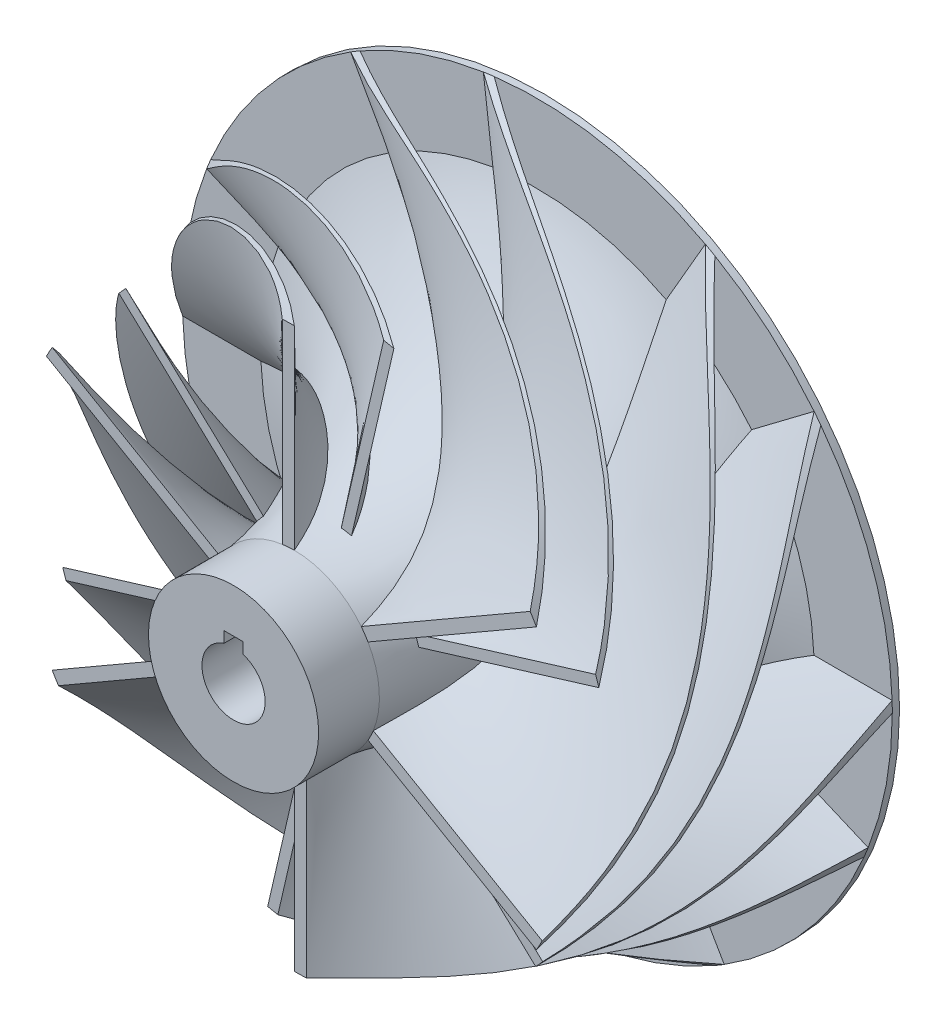
from build123d import *
from build123d.topology import SkipClean

# Parameters (mm, degrees)
CROQUIS1_R              = 37.21
SALIENTE_EXTRUIR1_DEPTH = 0.762
CROQUIS2_R              = 8.89
SALIENTE_EXTRUIR2_DEPTH = 25.4
MATRIZC1_COUNT          = 6
CROQUIS6_R              = 8.89
SALIENTE_EXTRUIR3_DEPTH = 6.35
CROQUIS7_R              = 3.3
CORTAR_EXTRUIR1_DEPTH   = 36.83
CORTAR_EXTRUIR4_START   = -3.81
CORTAR_EXTRUIR4_DEPTH   = 3.81
MATRIZC3_COUNT          = 6
CROQUIS10_R             = 5.97
CROQUIS10_R_2           = 3.3
SALIENTE_EXTRUIR5_DEPTH = 5.588
CORTAR_EXTRUIR5_START   = -46
CORTAR_EXTRUIR5_DEPTH   = 46


with BuildPart() as part:
    # Croquis1 → Saliente-Extruir1 (new body)
    with BuildSketch(Plane.XY):
        with Locations(Location((0, 0, 0), (0, 0, 180))):
            Circle(CROQUIS1_R)
    extrude(amount=SALIENTE_EXTRUIR1_DEPTH)

    # Croquis2 → Saliente-Extruir2 (add)
    with BuildSketch(Plane.XY.offset(0.762)):
        Circle(CROQUIS2_R)
    extrude(amount=SALIENTE_EXTRUIR2_DEPTH)

    # Recubrir1: read off the stored shape, not the designer's step
    # Recubrir1: loft between two sections, ruled curve by curve
    recubrir1_from = [
        Edge.make_bspline([(76.29, 1.14, 0.762), (63.575, 1.14, 0.762), (50.86, 1.14, 0.762), (25.43, 1.14, 0.762), (12.715, 1.14, 0.762), (0, 1.14, 0.762)], [0, 0, 0, 0, 0.5, 0.5, 1, 1, 1, 1], 3),
        Edge.make_bspline([(0, 0, 0.762), (12.715, 0, 0.762), (25.43, 0, 0.762), (50.86, 0, 0.762), (63.575, 0, 0.762), (76.29, 0, 0.762)], [0, 0, 0, 0, 0.5, 0.5, 1, 1, 1, 1], 3),
        Edge.make_bspline([(76.29, 0, 0.762), (76.29, 0.19, 0.762), (76.29, 0.38, 0.762), (76.29, 0.76, 0.762), (76.29, 0.95, 0.762), (76.29, 1.14, 0.762)], [0, 0, 0, 0, 0.5, 0.5, 1, 1, 1, 1], 3),
        Edge.make_line((0, 0, 0.762), (0, 1.14, 0.762)),
    ]
    recubrir1_to = [
        Edge.make_bspline([(1.26, -76.4, 26.162), (1.26, -63.666666667, 26.162), (1.26, -50.933333333, 26.162), (1.26, -25.466666667, 26.162), (1.26, -12.733333333, 26.162), (1.26, 0, 26.162)], [0, 0, 0, 0, 0.5, 0.5, 1, 1, 1, 1], 3),
        Edge.make_bspline([(0, 0, 26.162), (0, -12.733333333, 26.162), (0, -25.466666667, 26.162), (0, -50.933333333, 26.162), (0, -63.666666667, 26.162), (0, -76.4, 26.162)], [0, 0, 0, 0, 0.5, 0.5, 1, 1, 1, 1], 3),
        Edge.make_bspline([(0, -76.4, 26.162), (0.21, -76.4, 26.162), (0.42, -76.4, 26.162), (0.84, -76.4, 26.162), (1.05, -76.4, 26.162), (1.26, -76.4, 26.162)], [0, 0, 0, 0, 0.5, 0.5, 1, 1, 1, 1], 3),
        Edge.make_line((0, 0, 26.162), (1.26, 0, 26.162)),
    ]
    recubrir1 = Solid(Shell([*[Face.make_surface_from_curves(recubrir1_from[k], recubrir1_to[k]) for k in range(4)], Face(Wire(recubrir1_from)), Face(Wire(recubrir1_to))]))
    add(recubrir1)

    # MatrizC1: Recubrir1 ×6 about axis
    matrizc1_axis = Axis((0, 0, 26.1619), (0, 0, -1))
    for i in range(1, MATRIZC1_COUNT):
        add(recubrir1.rotate(matrizc1_axis, i * 360 / MATRIZC1_COUNT))

    # MatrizC2: read off the stored shape, not the designer's step
    # MatrizC2: loft between two sections, ruled curve by curve
    matrizc2_from = [
        Edge.make_bspline([(70.670748756, -28.75950226, 0.762), (58.966529545, -23.791355961, 0.762), (47.262310333, -18.823209662, 0.762), (23.85387191, -8.886917065, 0.762), (12.149652698, -3.918770766, 0.762), (0.445433486, 1.049375533, 0.762)], [0, 0, 0, 0, 0.5, 0.5, 1, 1, 1, 1], 3),
        Edge.make_bspline([(0, 0, 0.762), (11.704219212, -4.968146299, 0.762), (23.408438423, -9.936292597, 0.762), (46.816876847, -19.872585195, 0.762), (58.521096058, -24.840731494, 0.762), (70.22531527, -29.808877792, 0.762)], [0, 0, 0, 0, 0.5, 0.5, 1, 1, 1, 1], 3),
        Edge.make_bspline([(70.22531527, -29.808877792, 0.762), (70.299554184, -29.63398187, 0.762), (70.373793099, -29.459085948, 0.762), (70.522270928, -29.109294104, 0.762), (70.596509842, -28.934398182, 0.762), (70.670748756, -28.75950226, 0.762)], [0, 0, 0, 0, 0.5, 0.5, 1, 1, 1, 1], 3),
        Edge.make_line((0, 0, 0.762), (0.445433486, 1.049375533, 0.762)),
    ]
    matrizc2_to = [
        Edge.make_bspline([(-28.692022101, -70.818892026, 26.162), (-23.716712398, -59.097796892, 26.162), (-18.741402696, -47.376701758, 26.162), (-8.79078329, -23.93451149, 26.162), (-3.815473587, -12.213416356, 26.162), (1.159836115, -0.492321222, 26.162)], [0, 0, 0, 0, 0.5, 0.5, 1, 1, 1, 1], 3),
        Edge.make_bspline([(0, 0, 26.162), (-4.975309703, -11.721095134, 26.162), (-9.950619406, -23.442190268, 26.162), (-19.901238811, -46.884380536, 26.162), (-24.876548514, -58.60547567, 26.162), (-29.851858217, -70.326570804, 26.162)], [0, 0, 0, 0, 0.5, 0.5, 1, 1, 1, 1], 3),
        Edge.make_bspline([(-29.851858217, -70.326570804, 26.162), (-29.658552197, -70.408624341, 26.162), (-29.465246178, -70.490677878, 26.162), (-29.07863414, -70.654784952, 26.162), (-28.88532812, -70.736838489, 26.162), (-28.692022101, -70.818892026, 26.162)], [0, 0, 0, 0, 0.5, 0.5, 1, 1, 1, 1], 3),
        Edge.make_line((0, 0, 26.162), (1.159836115, -0.492321222, 26.162)),
    ]
    matrizc2 = Solid(Shell([*[Face.make_surface_from_curves(matrizc2_from[k], matrizc2_to[k]) for k in range(4)], Face(Wire(matrizc2_from)), Face(Wire(matrizc2_to))]))
    add(matrizc2)

    # MatrizC2 2: loft between two sections, ruled curve by curve
    matrizc2_2_from = [
        Edge.make_bspline([(10.428914821, -75.582414857, 0.762), (8.87934612, -62.962190539, 0.762), (7.329777418, -50.341966221, 0.762), (4.230640016, -25.101517585, 0.762), (2.681071314, -12.481293267, 0.762), (1.131502613, 0.138931051, 0.762)], [0, 0, 0, 0, 0.5, 0.5, 1, 1, 1, 1], 3),
        Edge.make_bspline([(0, 0, 0.762), (1.549568701, -12.620224318, 0.762), (3.099137403, -25.240448636, 0.762), (6.198274806, -50.480897272, 0.762), (7.747843507, -63.101121591, 0.762), (9.297412208, -75.721345909, 0.762)], [0, 0, 0, 0, 0.5, 0.5, 1, 1, 1, 1], 3),
        Edge.make_bspline([(9.297412208, -75.721345909, 0.762), (9.485995977, -75.698190733, 0.762), (9.674579746, -75.675035558, 0.762), (10.051747284, -75.628725208, 0.762), (10.240331052, -75.605570032, 0.762), (10.428914821, -75.582414857, 0.762)], [0, 0, 0, 0, 0.5, 0.5, 1, 1, 1, 1], 3),
        Edge.make_line((0, 0, 0.762), (1.131502613, 0.138931051, 0.762)),
    ]
    matrizc2_2_to = [
        Edge.make_bspline([(-75.676970613, -10.561425987, 26.162), (-63.038549615, -9.009623015, 26.162), (-50.400128618, -7.457820042, 26.162), (-25.123286622, -4.354214096, 26.162), (-12.484865625, -2.802411124, 26.162), (0.153555373, -1.250608151, 26.162)], [0, 0, 0, 0, 0.5, 0.5, 1, 1, 1, 1], 3),
        Edge.make_bspline([(0, 0, 26.162), (-12.638420998, -1.551802973, 26.162), (-25.276841995, -3.103605945, 26.162), (-50.55368399, -6.207211891, 26.162), (-63.192104988, -7.759014863, 26.162), (-75.830525985, -9.310817836, 26.162)], [0, 0, 0, 0, 0.5, 0.5, 1, 1, 1, 1], 3),
        Edge.make_bspline([(-75.830525985, -9.310817836, 26.162), (-75.804933423, -9.519252528, 26.162), (-75.779340861, -9.72768722, 26.162), (-75.728155737, -10.144556604, 26.162), (-75.702563175, -10.352991295, 26.162), (-75.676970613, -10.561425987, 26.162)], [0, 0, 0, 0, 0.5, 0.5, 1, 1, 1, 1], 3),
        Edge.make_line((0, 0, 26.162), (0.153555373, -1.250608151, 26.162)),
    ]
    matrizc2_2 = Solid(Shell([*[Face.make_surface_from_curves(matrizc2_2_from[k], matrizc2_2_to[k]) for k in range(4)], Face(Wire(matrizc2_2_from)), Face(Wire(matrizc2_2_to))]))
    add(matrizc2_2)

    # MatrizC2 3: loft between two sections, ruled curve by curve
    matrizc2_3_from = [
        Edge.make_bspline([(-60.241833935, -46.822912598, 0.762), (-50.087183425, -39.170834578, 0.762), (-39.932532915, -31.518756559, 0.762), (-19.623231894, -16.21460052, 0.762), (-9.468581384, -8.562522501, 0.762), (0.686069126, -0.910444481, 0.762)], [0, 0, 0, 0, 0.5, 0.5, 1, 1, 1, 1], 3),
        Edge.make_bspline([(0, 0, 0.762), (-10.15465051, -7.652078019, 0.762), (-20.309301021, -15.304156039, 0.762), (-40.618602041, -30.608312078, 0.762), (-50.773252551, -38.260390097, 0.762), (-60.927903062, -45.912468116, 0.762)], [0, 0, 0, 0, 0.5, 0.5, 1, 1, 1, 1], 3),
        Edge.make_bspline([(-60.927903062, -45.912468116, 0.762), (-60.813558207, -46.064208863, 0.762), (-60.699213353, -46.21594961, 0.762), (-60.470523644, -46.519431104, 0.762), (-60.35617879, -46.671171851, 0.762), (-60.241833935, -46.822912598, 0.762)], [0, 0, 0, 0, 0.5, 0.5, 1, 1, 1, 1], 3),
        Edge.make_line((0, 0, 0.762), (0.686069126, -0.910444481, 0.762)),
    ]
    matrizc2_3_to = [
        Edge.make_bspline([(-46.984948511, 60.257466038, 26.162), (-39.321837217, 50.088173877, 26.162), (-31.658725922, 39.918881716, 26.162), (-16.332503332, 19.580297393, 26.162), (-8.669392037, 9.411005232, 26.162), (-1.006280743, -0.758286929, 26.162)], [0, 0, 0, 0, 0.5, 0.5, 1, 1, 1, 1], 3),
        Edge.make_bspline([(0, 0, 26.162), (-7.663111295, 10.169292161, 26.162), (-15.32622259, 20.338584323, 26.162), (-30.652445179, 40.677168645, 26.162), (-38.315556474, 50.846460806, 26.162), (-45.978667769, 61.015752968, 26.162)], [0, 0, 0, 0, 0.5, 0.5, 1, 1, 1, 1], 3),
        Edge.make_bspline([(-45.978667769, 61.015752968, 26.162), (-46.146381226, 60.889371813, 26.162), (-46.314094683, 60.762990658, 26.162), (-46.649521597, 60.510228348, 26.162), (-46.817235054, 60.383847193, 26.162), (-46.984948511, 60.257466038, 26.162)], [0, 0, 0, 0, 0.5, 0.5, 1, 1, 1, 1], 3),
        Edge.make_line((0, 0, 26.162), (-1.006280743, -0.758286929, 26.162)),
    ]
    matrizc2_3 = Solid(Shell([*[Face.make_surface_from_curves(matrizc2_3_from[k], matrizc2_3_to[k]) for k in range(4)], Face(Wire(matrizc2_3_from)), Face(Wire(matrizc2_3_to))]))
    add(matrizc2_3)

    # MatrizC2 4: loft between two sections, ruled curve by curve
    matrizc2_4_from = [
        Edge.make_bspline([(-70.670748756, 28.75950226, 0.762), (-58.966529545, 23.791355961, 0.762), (-47.262310333, 18.823209662, 0.762), (-23.85387191, 8.886917065, 0.762), (-12.149652698, 3.918770766, 0.762), (-0.445433486, -1.049375533, 0.762)], [0, 0, 0, 0, 0.5, 0.5, 1, 1, 1, 1], 3),
        Edge.make_bspline([(0, 0, 0.762), (-11.704219212, 4.968146299, 0.762), (-23.408438423, 9.936292597, 0.762), (-46.816876847, 19.872585195, 0.762), (-58.521096058, 24.840731494, 0.762), (-70.22531527, 29.808877792, 0.762)], [0, 0, 0, 0, 0.5, 0.5, 1, 1, 1, 1], 3),
        Edge.make_bspline([(-70.22531527, 29.808877792, 0.762), (-70.299554184, 29.63398187, 0.762), (-70.373793099, 29.459085948, 0.762), (-70.522270928, 29.109294104, 0.762), (-70.596509842, 28.934398182, 0.762), (-70.670748756, 28.75950226, 0.762)], [0, 0, 0, 0, 0.5, 0.5, 1, 1, 1, 1], 3),
        Edge.make_line((0, 0, 0.762), (-0.445433486, -1.049375533, 0.762)),
    ]
    matrizc2_4_to = [
        Edge.make_bspline([(28.692022101, 70.818892026, 26.162), (23.716712398, 59.097796892, 26.162), (18.741402696, 47.376701758, 26.162), (8.79078329, 23.93451149, 26.162), (3.815473587, 12.213416356, 26.162), (-1.159836115, 0.492321222, 26.162)], [0, 0, 0, 0, 0.5, 0.5, 1, 1, 1, 1], 3),
        Edge.make_bspline([(0, 0, 26.162), (4.975309703, 11.721095134, 26.162), (9.950619406, 23.442190268, 26.162), (19.901238811, 46.884380536, 26.162), (24.876548514, 58.60547567, 26.162), (29.851858217, 70.326570804, 26.162)], [0, 0, 0, 0, 0.5, 0.5, 1, 1, 1, 1], 3),
        Edge.make_bspline([(29.851858217, 70.326570804, 26.162), (29.658552197, 70.408624341, 26.162), (29.465246178, 70.490677878, 26.162), (29.07863414, 70.654784952, 26.162), (28.88532812, 70.736838489, 26.162), (28.692022101, 70.818892026, 26.162)], [0, 0, 0, 0, 0.5, 0.5, 1, 1, 1, 1], 3),
        Edge.make_line((0, 0, 26.162), (-1.159836115, 0.492321222, 26.162)),
    ]
    matrizc2_4 = Solid(Shell([*[Face.make_surface_from_curves(matrizc2_4_from[k], matrizc2_4_to[k]) for k in range(4)], Face(Wire(matrizc2_4_from)), Face(Wire(matrizc2_4_to))]))
    add(matrizc2_4)

    # MatrizC2 5: loft between two sections, ruled curve by curve
    matrizc2_5_from = [
        Edge.make_bspline([(-10.428914821, 75.582414857, 0.762), (-8.87934612, 62.962190539, 0.762), (-7.329777418, 50.341966221, 0.762), (-4.230640016, 25.101517585, 0.762), (-2.681071314, 12.481293267, 0.762), (-1.131502613, -0.138931051, 0.762)], [0, 0, 0, 0, 0.5, 0.5, 1, 1, 1, 1], 3),
        Edge.make_bspline([(0, 0, 0.762), (-1.549568701, 12.620224318, 0.762), (-3.099137403, 25.240448636, 0.762), (-6.198274806, 50.480897272, 0.762), (-7.747843507, 63.101121591, 0.762), (-9.297412208, 75.721345909, 0.762)], [0, 0, 0, 0, 0.5, 0.5, 1, 1, 1, 1], 3),
        Edge.make_bspline([(-9.297412208, 75.721345909, 0.762), (-9.485995977, 75.698190733, 0.762), (-9.674579746, 75.675035558, 0.762), (-10.051747284, 75.628725208, 0.762), (-10.240331052, 75.605570032, 0.762), (-10.428914821, 75.582414857, 0.762)], [0, 0, 0, 0, 0.5, 0.5, 1, 1, 1, 1], 3),
        Edge.make_line((0, 0, 0.762), (-1.131502613, -0.138931051, 0.762)),
    ]
    matrizc2_5_to = [
        Edge.make_bspline([(75.676970613, 10.561425987, 26.162), (63.038549615, 9.009623015, 26.162), (50.400128618, 7.457820042, 26.162), (25.123286622, 4.354214096, 26.162), (12.484865625, 2.802411124, 26.162), (-0.153555373, 1.250608151, 26.162)], [0, 0, 0, 0, 0.5, 0.5, 1, 1, 1, 1], 3),
        Edge.make_bspline([(0, 0, 26.162), (12.638420998, 1.551802973, 26.162), (25.276841995, 3.103605945, 26.162), (50.55368399, 6.207211891, 26.162), (63.192104988, 7.759014863, 26.162), (75.830525985, 9.310817836, 26.162)], [0, 0, 0, 0, 0.5, 0.5, 1, 1, 1, 1], 3),
        Edge.make_bspline([(75.830525985, 9.310817836, 26.162), (75.804933423, 9.519252528, 26.162), (75.779340861, 9.72768722, 26.162), (75.728155737, 10.144556604, 26.162), (75.702563175, 10.352991295, 26.162), (75.676970613, 10.561425987, 26.162)], [0, 0, 0, 0, 0.5, 0.5, 1, 1, 1, 1], 3),
        Edge.make_line((0, 0, 26.162), (-0.153555373, 1.250608151, 26.162)),
    ]
    matrizc2_5 = Solid(Shell([*[Face.make_surface_from_curves(matrizc2_5_from[k], matrizc2_5_to[k]) for k in range(4)], Face(Wire(matrizc2_5_from)), Face(Wire(matrizc2_5_to))]))
    add(matrizc2_5)

    # MatrizC2 6: loft between two sections, ruled curve by curve
    matrizc2_6_from = [
        Edge.make_bspline([(60.241833935, 46.822912598, 0.762), (50.087183425, 39.170834578, 0.762), (39.932532915, 31.518756559, 0.762), (19.623231894, 16.21460052, 0.762), (9.468581384, 8.562522501, 0.762), (-0.686069126, 0.910444481, 0.762)], [0, 0, 0, 0, 0.5, 0.5, 1, 1, 1, 1], 3),
        Edge.make_bspline([(0, 0, 0.762), (10.15465051, 7.652078019, 0.762), (20.309301021, 15.304156039, 0.762), (40.618602041, 30.608312078, 0.762), (50.773252551, 38.260390097, 0.762), (60.927903062, 45.912468116, 0.762)], [0, 0, 0, 0, 0.5, 0.5, 1, 1, 1, 1], 3),
        Edge.make_bspline([(60.927903062, 45.912468116, 0.762), (60.813558207, 46.064208863, 0.762), (60.699213353, 46.21594961, 0.762), (60.470523644, 46.519431104, 0.762), (60.35617879, 46.671171851, 0.762), (60.241833935, 46.822912598, 0.762)], [0, 0, 0, 0, 0.5, 0.5, 1, 1, 1, 1], 3),
        Edge.make_line((0, 0, 0.762), (-0.686069126, 0.910444481, 0.762)),
    ]
    matrizc2_6_to = [
        Edge.make_bspline([(46.984948511, -60.257466038, 26.162), (39.321837217, -50.088173877, 26.162), (31.658725922, -39.918881716, 26.162), (16.332503332, -19.580297393, 26.162), (8.669392037, -9.411005232, 26.162), (1.006280743, 0.758286929, 26.162)], [0, 0, 0, 0, 0.5, 0.5, 1, 1, 1, 1], 3),
        Edge.make_bspline([(0, 0, 26.162), (7.663111295, -10.169292161, 26.162), (15.32622259, -20.338584323, 26.162), (30.652445179, -40.677168645, 26.162), (38.315556474, -50.846460806, 26.162), (45.978667769, -61.015752968, 26.162)], [0, 0, 0, 0, 0.5, 0.5, 1, 1, 1, 1], 3),
        Edge.make_bspline([(45.978667769, -61.015752968, 26.162), (46.146381226, -60.889371813, 26.162), (46.314094683, -60.762990658, 26.162), (46.649521597, -60.510228348, 26.162), (46.817235054, -60.383847193, 26.162), (46.984948511, -60.257466038, 26.162)], [0, 0, 0, 0, 0.5, 0.5, 1, 1, 1, 1], 3),
        Edge.make_line((0, 0, 26.162), (1.006280743, 0.758286929, 26.162)),
    ]
    matrizc2_6 = Solid(Shell([*[Face.make_surface_from_curves(matrizc2_6_from[k], matrizc2_6_to[k]) for k in range(4)], Face(Wire(matrizc2_6_from)), Face(Wire(matrizc2_6_to))]))
    add(matrizc2_6)

    # Croquis5 → Cortar-Revolución1 (revolve, cut)
    with BuildSketch(Plane(origin=(0, 0, 0), x_dir=(1, 0, 0), z_dir=(0, 1, 0)), mode=Mode.PRIVATE) as cortar_revoluci_n1_sk:
        with BuildLine():
            Line((-29.21, -59.34), (-82.05, -48.32))
            Line((-82.05, -48.32), (-95.86, -5.93))
            Line((-95.86, -5.93), (-53.21, 12.99))
            Line((-53.21, 12.99), (-43.06, 5.06))
            Line((-43.06, 5.06), (-37.08, 5.06))
            Line((-37.08, 5.06), (-37.08, 0))
            Line((-37.08, 0), (-37.08, -0.762))
            ThreePointArc((-37.08, -0.762), (-31.051600953, -12.812324888), (-29.21, -26.16))
            Line((-29.21, -26.16), (-29.21, -33.02))
            Line((-29.21, -33.02), (-29.21, -59.34))
        make_face()
    revolve(cortar_revoluci_n1_sk.sketch.rotate(Axis((0, 0, 26.1619), (0, 0, -1)), 180), axis=Axis((0, 0, 26.1619), (0, 0, -1)), mode=Mode.SUBTRACT)

    # Croquis6 → Saliente-Extruir3 (add)
    with BuildSketch(Plane.XY.offset(26.162)):
        Circle(CROQUIS6_R)
    extrude(amount=SALIENTE_EXTRUIR3_DEPTH)

    # Croquis7 → Cortar-Extruir1 (cut)
    with BuildSketch(Plane.XY.offset(32.512)):
        Circle(CROQUIS7_R)
    extrude(amount=-CORTAR_EXTRUIR1_DEPTH, mode=Mode.SUBTRACT)

    # Croquis8 → Cortar-Extruir4 (cut)
    with SkipClean():  # the faces are left unmerged after this step: merging them gives an invalid solid
        with BuildSketch(Plane.XY.offset(26.162).offset(CORTAR_EXTRUIR4_START)):
            with BuildLine():
                Line((7.69896584, 4.445), (42.893074548, 14.097775109))
                Line((42.893074548, 14.097775109), (45.361379742, 5.098311187))
                Line((45.361379742, 5.098311187), (8.660814524, -2.005590131))
                ThreePointArc((8.660814524, -2.005590131), (8.792788616, 1.311094333), (7.69896584, 4.445))
            make_face()
        cortar_extruir4 = extrude(amount=CORTAR_EXTRUIR4_DEPTH, mode=Mode.SUBTRACT)

    # MatrizC3: Cortar-Extruir4 ×6 about axis
    with SkipClean():  # the faces are left unmerged after this step: merging them gives an invalid solid
        matrizc3_axis = Axis((0, 0, 0), (0, 0, 1))
        for i in range(1, MATRIZC3_COUNT):
            add(cortar_extruir4.rotate(matrizc3_axis, i * 360 / MATRIZC3_COUNT), mode=Mode.SUBTRACT)

    # Croquis9 → Revolución1 (revolve)
    with BuildSketch(Plane(origin=(0, 0, 0), x_dir=(1, 0, 0), z_dir=(0, 1, 0)), mode=Mode.PRIVATE) as revoluci_n1_sk:
        with BuildLine():
            Line((-7.53, 0), (-28.913336772, -0.762))
            ThreePointArc((-28.913336772, -0.762), (-15.386304939, -10.690767474), (-8.89, -26.162))
            Line((-8.89, -26.162), (-4.82, -24.95))
            Line((-4.82, -24.95), (-7.53, 0))
        make_face()
    revolve(revoluci_n1_sk.sketch.rotate(Axis((0, 0, 26.1619), (0, 0, -1)), 21.851901558), axis=Axis((0, 0, 26.1619), (0, 0, -1)))

    # Croquis10 → Saliente-Extruir5 (add)
    with BuildSketch(Plane(origin=(0, 0, 0), x_dir=(-1, 0, 0), z_dir=(0, 0, -1))):
        with Locations(Location((0, 0, 0), (0, 0, 180))):
            Circle(CROQUIS10_R)
        with Locations(Location((0, 0, 0), (0, 0, 180))):
            Circle(CROQUIS10_R_2, mode=Mode.SUBTRACT)
    extrude(amount=SALIENTE_EXTRUIR5_DEPTH)

    # Croquis11 → Revolución2 (revolve)
    with BuildSketch(Plane(origin=(0, 0, 0), x_dir=(1, 0, 0), z_dir=(0, 1, 0)), mode=Mode.PRIVATE) as revoluci_n2_sk:
        with BuildLine():
            Line((-5.97, 5.588), (-4.61, 0))
            Line((-4.61, 0), (-26.11, 0))
            ThreePointArc((-26.11, 0), (-15.683249411, 1.508216739), (-5.97, 5.588))
        make_face()
    revolve(revoluci_n2_sk.sketch.rotate(Axis((0, 0, 26.1619), (0, 0, -1)), 180), axis=Axis((0, 0, 26.1619), (0, 0, -1)))

    # Croquis12 → Cortar-Extruir5 (cut)
    with BuildSketch(Plane(origin=(0, 0, -5.588), x_dir=(-1, 0, 0), z_dir=(0, 0, -1)).offset(CORTAR_EXTRUIR5_START)):
        with BuildLine():
            Line((-1, 4.3), (1, 4.3))
            Line((1, 4.3), (1, 3.144837039))
            ThreePointArc((1, 3.144837039), (0, 3.3), (-1, 3.144837039))
            Line((-1, 3.144837039), (-1, 4.3))
        make_face()
    extrude(amount=CORTAR_EXTRUIR5_DEPTH, mode=Mode.SUBTRACT)


solid = part.part
